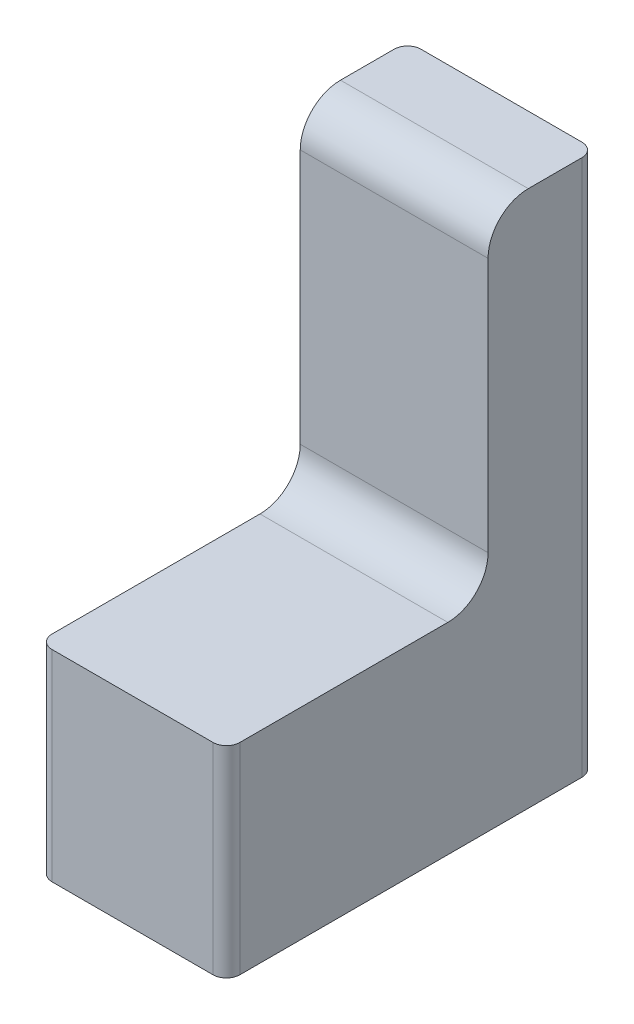
from build123d import *

# Parameters (mm, degrees)
SKETCH1_W                   = 14
SKETCH1_H                   = 27.5
BOSS_EXTRUDE1_DEPTH         = 40
CUT_EXTRUDE1_REACH          = 46.554
SKETCH2_W                   = 19.5
SKETCH2_H                   = 25
FILLET1_R                   = 3
M6_TAPPED_HOLE1_D           = 5
M6_TAPPED_HOLE1_DEPTH       = 12
M6_TAPPED_HOLE1_CSINK_D     = 6.05
M6_TAPPED_HOLE1_CSINK_ANGLE = 90
M6_TAPPED_HOLE1_TIP         = 1.502151548
FILLET2_R                   = 1


with BuildPart() as part:
    # Sketch1 → Boss-Extrude1 (new body)
    with BuildSketch(Plane(origin=(0, 0, 0), x_dir=(1, 0, 0), z_dir=(0, 1, 0))):
        Rectangle(SKETCH1_W, SKETCH1_H)
    extrude(amount=-BOSS_EXTRUDE1_DEPTH)

    # Sketch2 → Cut-Extrude1 (cut, up to next)
    with BuildSketch(Plane(origin=(7, 0, 0), x_dir=(0, 0, -1), z_dir=(1, 0, 0)), mode=Mode.PRIVATE) as cut_extrude1_sk1:
        with Locations((-4, -12.5)):
            Rectangle(SKETCH2_W, SKETCH2_H)
    cut_extrude1_tool1 = extrude(cut_extrude1_sk1.sketch, amount=-CUT_EXTRUDE1_REACH, mode=Mode.PRIVATE) & part.part
    add(cut_extrude1_tool1.solids().sort_by_distance((7, -12.5, 4))[0], mode=Mode.SUBTRACT)

    # Fillet1
    fillet1_edges = [part.edges().sort_by_distance(p)[0] for p in [
        (0, -25, -5.75),
        (0, 0, -5.75),
    ]]
    fillet(fillet1_edges, radius=FILLET1_R)

    # M6 Tapped Hole1
    with Locations(Plane(origin=(0, -40, 0), x_dir=(-1, 0, 0), z_dir=(0, -1, 0))):
        with Locations((0, -7.75), (0, 7.75)):
            CounterSinkHole(M6_TAPPED_HOLE1_D / 2, M6_TAPPED_HOLE1_CSINK_D / 2, depth=M6_TAPPED_HOLE1_DEPTH, counter_sink_angle=M6_TAPPED_HOLE1_CSINK_ANGLE)
            with Locations((0, 0, -(M6_TAPPED_HOLE1_DEPTH + M6_TAPPED_HOLE1_TIP / 2))):  # 118° drill point
                Cone(0, M6_TAPPED_HOLE1_D / 2, M6_TAPPED_HOLE1_TIP, mode=Mode.SUBTRACT)

    # Fillet2
    fillet2_edges = [part.edges().sort_by_distance(p)[0] for p in [
        (-7, -20, -13.75),
        (7, -20, -13.75),
        (7, -32.5, 13.75),
        (-7, -32.5, 13.75),
    ]]
    fillet(fillet2_edges, radius=FILLET2_R)


solid = part.part
